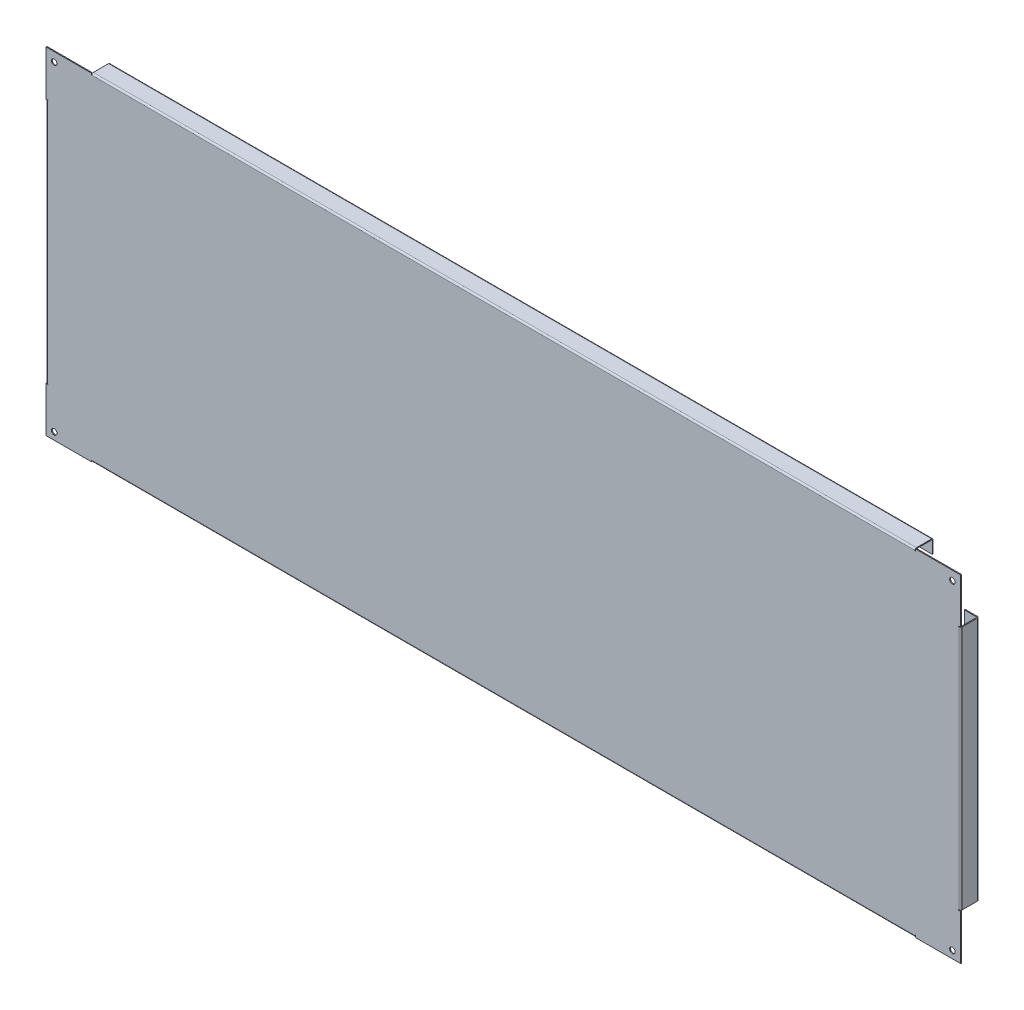
from build123d import *

# Parameters (mm, degrees)
SKETCH_1_W                         = 1000
SKETCH_1_H                         = 368
SM_BASE_FLANGE_1_DEPTH             = 1
OTHER_START                        = -134.5
OTHER_1_DEPTH                      = 269
OTHER_1_2_DEPTH                    = 0.5
OTHER_START_2                      = 134
OTHER_1_3_DEPTH                    = 0.5
OTHER_START_3                      = -134
OTHER_1_4_DEPTH                    = 268
OTHER_START_4                      = -450.5
OTHER_2_DEPTH                      = 901
OTHER_2_2_DEPTH                    = 0.5
OTHER_START_5                      = 450
OTHER_2_3_DEPTH                    = 0.5
OTHER_START_6                      = -450
OTHER_2_4_DEPTH                    = 900
SM_EDGE_FLANGE_1_STRIP_W           = 5.4732
SM_EDGE_FLANGE_1_STRIP_H           = 1
SM_EDGE_FLANGE_1_STRIP_CUT_DEPTH   = 900
SM_EDGE_FLANGE_1_RELIEF_W          = 5.9732
SM_EDGE_FLANGE_1_RELIEF_H          = 0.5
SM_EDGE_FLANGE_1_RELIEF_CUT_DEPTH  = 1
SM_EDGE_FLANGE_1_DEPTH             = 900
SM_EDGE_FLANGE_1_FLAT_DEPTH        = 1
SM_EDGE_FLANGE_2_STRIP_W           = 5.4732
SM_EDGE_FLANGE_2_STRIP_H           = 1
SM_EDGE_FLANGE_2_STRIP_CUT_DEPTH   = 214.5
SM_EDGE_FLANGE_2_STRIP_2_W         = 5.4732
SM_EDGE_FLANGE_2_STRIP_2_H         = 1
SM_EDGE_FLANGE_2_STRIP_CUT_2_DEPTH = 412
SM_EDGE_FLANGE_2_STRIP_3_W         = 5.4732
SM_EDGE_FLANGE_2_STRIP_3_H         = 1
SM_EDGE_FLANGE_2_STRIP_CUT_3_DEPTH = 213.5
SM_EDGE_FLANGE_2_DEPTH             = 214.5
SM_EDGE_FLANGE_2_BEND_DEPTH        = 412
SM_EDGE_FLANGE_2_BEND_2_DEPTH      = 213.5
SKETCH_19_R                        = 3
CUT_EXTRUDE_1_DEPTH                = 534.120061525


# Read off the part's stored shape, not the designer's step: 斜接法兰1, 斜接法兰2
# Sheet-metal steps are written as plain solids
with BuildPart() as part:
    # Sketch 1 → 基体-法兰1 (new body)
    with BuildSketch(Plane.XY):
        Rectangle(SKETCH_1_W, SKETCH_1_H)
    extrude(amount=-SM_BASE_FLANGE_1_DEPTH)

    # Other 1 outline → Other 1 (cut)
    with BuildSketch(Plane(origin=(0, 0, 0), x_dir=(1, 0, 0), z_dir=(0, 1, 0)).offset(OTHER_START)):
        with BuildLine():
            Line((500, 1), (499.83604109, 1))
            ThreePointArc((499.83604109, 1), (499.195226164, 0.271171885), (498.2634, 0))
            Line((498.2634, 0), (500, 0))
            Line((500, 0), (500, 1))
        make_face()
    other_1 = extrude(amount=OTHER_1_DEPTH, mode=Mode.SUBTRACT)

    # Other 1 2 outline → Other 1 2 (cut)
    with BuildSketch(Plane(origin=(0, 0, 0), x_dir=(1, 0, 0), z_dir=(0, 1, 0)).offset(OTHER_START)):
        with BuildLine():
            ThreePointArc((498.2634, 0), (499.195226164, 0.271171885), (499.83604109, 1))
            Line((499.83604109, 1), (497.7634, 1))
            Line((497.7634, 1), (497.7634, 0))
            Line((497.7634, 0), (498.2634, 0))
        make_face()
    other_1_2 = extrude(amount=OTHER_1_2_DEPTH, mode=Mode.SUBTRACT)

    # Other 1 3 outline → Other 1 3 (cut)
    with BuildSketch(Plane(origin=(0, 0, 0), x_dir=(1, 0, 0), z_dir=(0, 1, 0)).offset(OTHER_START_2)):
        with BuildLine():
            ThreePointArc((498.2634, 0), (499.195226164, 0.271171885), (499.83604109, 1))
            Line((499.83604109, 1), (497.7634, 1))
            Line((497.7634, 1), (497.7634, 0))
            Line((497.7634, 0), (498.2634, 0))
        make_face()
    other_1_3 = extrude(amount=OTHER_1_3_DEPTH, mode=Mode.SUBTRACT)

    # Other 1 4 outline → Other 1 4 (add)
    with BuildSketch(Plane(origin=(0, 0, 0), x_dir=(1, 0, 0), z_dir=(0, 1, 0)).offset(OTHER_START_3)):
        with BuildLine():
            Line((500, 1.7366), (500, 18.2634))
            ThreePointArc((500, 18.2634), (499.491361636, 19.491361636), (498.2634, 20))
            Line((498.2634, 20), (485, 20))
            Line((485, 20), (485, 19))
            Line((485, 19), (498.2634, 19))
            ThreePointArc((498.2634, 19), (498.784254855, 18.784254855), (499, 18.2634))
            Line((499, 18.2634), (499, 1.7366))
            ThreePointArc((499, 1.7366), (498.784254855, 1.215745145), (498.2634, 1))
            Line((498.2634, 1), (499.83604109, 1))
            ThreePointArc((499.83604109, 1), (499.958514757, 1.359286442), (500, 1.7366))
        make_face()
    other_1_4 = extrude(amount=OTHER_1_4_DEPTH)

    # Other 2 outline → Other 2 (cut)
    with BuildSketch(Plane.YZ.offset(OTHER_START_4)):
        with BuildLine():
            ThreePointArc((182.2634, 0), (183.195226164, -0.271171885), (183.83604109, -1))
            Line((183.83604109, -1), (184, -1))
            Line((184, -1), (184, 0))
            Line((184, 0), (182.2634, 0))
        make_face()
    extrude(amount=OTHER_2_DEPTH, mode=Mode.SUBTRACT)

    # Other 2 2 outline → Other 2 2 (cut)
    with BuildSketch(Plane.YZ.offset(OTHER_START_4)):
        with BuildLine():
            Line((181.7634, -1), (183.83604109, -1))
            ThreePointArc((183.83604109, -1), (183.195226164, -0.271171885), (182.2634, 0))
            Line((182.2634, 0), (181.7634, 0))
            Line((181.7634, 0), (181.7634, -1))
        make_face()
    extrude(amount=OTHER_2_2_DEPTH, mode=Mode.SUBTRACT)

    # Other 2 3 outline → Other 2 3 (cut)
    with BuildSketch(Plane.YZ.offset(OTHER_START_5)):
        with BuildLine():
            Line((181.7634, -1), (183.83604109, -1))
            ThreePointArc((183.83604109, -1), (183.195226164, -0.271171885), (182.2634, 0))
            Line((182.2634, 0), (181.7634, 0))
            Line((181.7634, 0), (181.7634, -1))
        make_face()
    extrude(amount=OTHER_2_3_DEPTH, mode=Mode.SUBTRACT)

    # Other 2 4 outline → Other 2 4 (add)
    with BuildSketch(Plane.YZ.offset(OTHER_START_6)):
        with BuildLine():
            Line((184, -18.2634), (184, -1.7366))
            ThreePointArc((184, -1.7366), (183.958514757, -1.359286442), (183.83604109, -1))
            Line((183.83604109, -1), (182.2634, -1))
            ThreePointArc((182.2634, -1), (182.784254855, -1.215745145), (183, -1.7366))
            Line((183, -1.7366), (183, -18.2634))
            ThreePointArc((183, -18.2634), (182.784254855, -18.784254855), (182.2634, -19))
            Line((182.2634, -19), (169, -19))
            Line((169, -19), (169, -20))
            Line((169, -20), (182.2634, -20))
            ThreePointArc((182.2634, -20), (183.491361636, -19.491361636), (184, -18.2634))
        make_face()
    extrude(amount=OTHER_2_4_DEPTH)

    # 镜向1: Other 1, Other 1 2, Other 1 3, Other 1 4 across plane
    add(other_1.mirror(Plane(origin=(0, 0, 0), x_dir=(0, 0, 1), z_dir=(1, 0, 0))), mode=Mode.SUBTRACT)
    add(other_1_2.mirror(Plane(origin=(0, 0, 0), x_dir=(0, 0, 1), z_dir=(1, 0, 0))), mode=Mode.SUBTRACT)
    add(other_1_3.mirror(Plane(origin=(0, 0, 0), x_dir=(0, 0, 1), z_dir=(1, 0, 0))), mode=Mode.SUBTRACT)
    add(other_1_4.mirror(Plane(origin=(0, 0, 0), x_dir=(0, 0, 1), z_dir=(1, 0, 0))))

    # 边线-法兰1 strip (across the edge) → 边线-法兰1 strip cut (cut)
    with BuildSketch(Plane(origin=(450, -184, -1), x_dir=(0, 1, 0), z_dir=(-1, 0, 0))):
        with Locations((-1, -0.5)):
            Rectangle(SM_EDGE_FLANGE_1_STRIP_W, SM_EDGE_FLANGE_1_STRIP_H)
    extrude(amount=SM_EDGE_FLANGE_1_STRIP_CUT_DEPTH, mode=Mode.SUBTRACT)

    # 边线-法兰1 relief (on the sheet) → 边线-法兰1 relief cut (cut)
    with BuildSketch(Plane(origin=(450, -182.2634, -1), x_dir=(0, 1, 0), z_dir=(0, 0, -1))):
        with Locations((-2.4866, 0.25)):
            Rectangle(SM_EDGE_FLANGE_1_RELIEF_W, SM_EDGE_FLANGE_1_RELIEF_H)
        with Locations((-2.4866, -900.25)):
            Rectangle(SM_EDGE_FLANGE_1_RELIEF_W, SM_EDGE_FLANGE_1_RELIEF_H)
    extrude(amount=-SM_EDGE_FLANGE_1_RELIEF_CUT_DEPTH, mode=Mode.SUBTRACT)

    # 边线-法兰1 bend section (across the edge) → 边线-法兰1 (add)
    with BuildSketch(Plane(origin=(450, -184, -1), x_dir=(0, 1, 0), z_dir=(-1, 0, 0))):
        with BuildLine():
            Line((0, 0.7366), (1, 0.7366))
            ThreePointArc((1, 0.7366), (1.215745145, 0.215745145), (1.7366, 0))
            Line((1.7366, 0), (1.7366, -1))
            ThreePointArc((1.7366, -1), (0.508638364, -0.491361636), (0, 0.7366))
        make_face()
    extrude(amount=SM_EDGE_FLANGE_1_DEPTH)

    # 边线-法兰1 profile (on flange) → 边线-法兰1 flat (add)
    with BuildSketch(Plane(origin=(0, -184, -1), x_dir=(-1, 0, 0), z_dir=(0, -1, 0))):
        Polygon((-450, 0.7366), (450, 0.7366), (450, 19), (236.5, 19), (236.5, 1), (206.5, 1), (206.5, 19), (-205.5, 19), (-205.5, 1), (-235.5, 1), (-235.5, 19), (-450, 19), align=None)
    extrude(amount=-SM_EDGE_FLANGE_1_FLAT_DEPTH)

    # 边线-法兰2 strip (across the edge) → 边线-法兰2 strip cut (cut)
    with BuildSketch(Plane(origin=(450, -183, -20), x_dir=(0, 0, 1), z_dir=(-1, 0, 0))):
        with Locations((-1, -0.5)):
            Rectangle(SM_EDGE_FLANGE_2_STRIP_W, SM_EDGE_FLANGE_2_STRIP_H)
    extrude(amount=SM_EDGE_FLANGE_2_STRIP_CUT_DEPTH, mode=Mode.SUBTRACT)

    # 边线-法兰2 strip 2 (across the edge) → 边线-法兰2 strip cut 2 (cut)
    with BuildSketch(Plane(origin=(205.5, -183, -20), x_dir=(0, 0, 1), z_dir=(-1, 0, 0))):
        with Locations((-1, -0.5)):
            Rectangle(SM_EDGE_FLANGE_2_STRIP_2_W, SM_EDGE_FLANGE_2_STRIP_2_H)
    extrude(amount=SM_EDGE_FLANGE_2_STRIP_CUT_2_DEPTH, mode=Mode.SUBTRACT)

    # 边线-法兰2 strip 3 (across the edge) → 边线-法兰2 strip cut 3 (cut)
    with BuildSketch(Plane(origin=(-236.5, -183, -20), x_dir=(0, 0, 1), z_dir=(-1, 0, 0))):
        with Locations((-1, -0.5)):
            Rectangle(SM_EDGE_FLANGE_2_STRIP_3_W, SM_EDGE_FLANGE_2_STRIP_3_H)
    extrude(amount=SM_EDGE_FLANGE_2_STRIP_CUT_3_DEPTH, mode=Mode.SUBTRACT)

    # 边线-法兰2 section (across the edge) → 边线-法兰2 (add)
    with BuildSketch(Plane(origin=(450, -183, -20), x_dir=(0, 0, 1), z_dir=(-1, 0, 0))):
        with BuildLine():
            Line((0, 0.7366), (0, 14))
            Line((0, 14), (1, 14))
            Line((1, 14), (1, 0.7366))
            ThreePointArc((1, 0.7366), (1.215745145, 0.215745145), (1.7366, 0))
            Line((1.7366, 0), (1.7366, -1))
            ThreePointArc((1.7366, -1), (0.508638364, -0.491361636), (0, 0.7366))
        make_face()
    extrude(amount=SM_EDGE_FLANGE_2_DEPTH)

    # 边线-法兰2 section 2 (across the edge) → 边线-法兰2 bend (add)
    with BuildSketch(Plane(origin=(205.5, -183, -20), x_dir=(0, 0, 1), z_dir=(-1, 0, 0))):
        with BuildLine():
            Line((0, 0.7366), (0, 14))
            Line((0, 14), (1, 14))
            Line((1, 14), (1, 0.7366))
            ThreePointArc((1, 0.7366), (1.215745145, 0.215745145), (1.7366, 0))
            Line((1.7366, 0), (1.7366, -1))
            ThreePointArc((1.7366, -1), (0.508638364, -0.491361636), (0, 0.7366))
        make_face()
    extrude(amount=SM_EDGE_FLANGE_2_BEND_DEPTH)

    # 边线-法兰2 section 3 (across the edge) → 边线-法兰2 bend 2 (add)
    with BuildSketch(Plane(origin=(-236.5, -183, -20), x_dir=(0, 0, 1), z_dir=(-1, 0, 0))):
        with BuildLine():
            Line((0, 0.7366), (0, 14))
            Line((0, 14), (1, 14))
            Line((1, 14), (1, 0.7366))
            ThreePointArc((1, 0.7366), (1.215745145, 0.215745145), (1.7366, 0))
            Line((1.7366, 0), (1.7366, -1))
            ThreePointArc((1.7366, -1), (0.508638364, -0.491361636), (0, 0.7366))
        make_face()
    extrude(amount=SM_EDGE_FLANGE_2_BEND_2_DEPTH)

    # 草图19 → 切除-拉伸1 (cut, through all)
    with BuildSketch(Plane(origin=(0, 0, -1), x_dir=(-1, 0, 0), z_dir=(0, 0, -1))):
        with Locations((-491, 174)):
            Circle(SKETCH_19_R)
        with Locations((-491, -176)):
            Circle(SKETCH_19_R)
        with Locations((491, -176)):
            Circle(SKETCH_19_R)
        with Locations((491, 174)):
            Circle(SKETCH_19_R)
    extrude(amount=-CUT_EXTRUDE_1_DEPTH, mode=Mode.SUBTRACT)


solid = part.part
